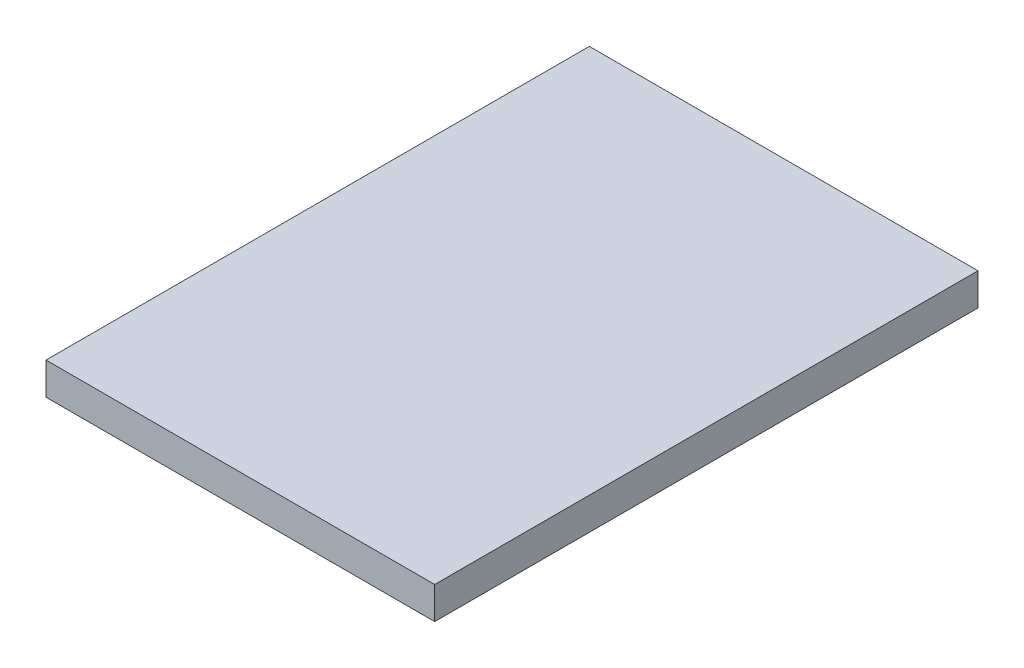
from build123d import *

# Parameters (mm, degrees)
SKETCH1_W           = 18.6
SKETCH1_H           = 26
BOSS_EXTRUDE1_DEPTH = 1.54


with BuildPart() as part:
    # Sketch1 → Boss-Extrude1 (new body)
    with BuildSketch(Plane(origin=(0, 0, 0), x_dir=(1, 0, 0), z_dir=(0, 1, 0))):
        Rectangle(SKETCH1_W, SKETCH1_H)
    extrude(amount=BOSS_EXTRUDE1_DEPTH)


solid = part.part
